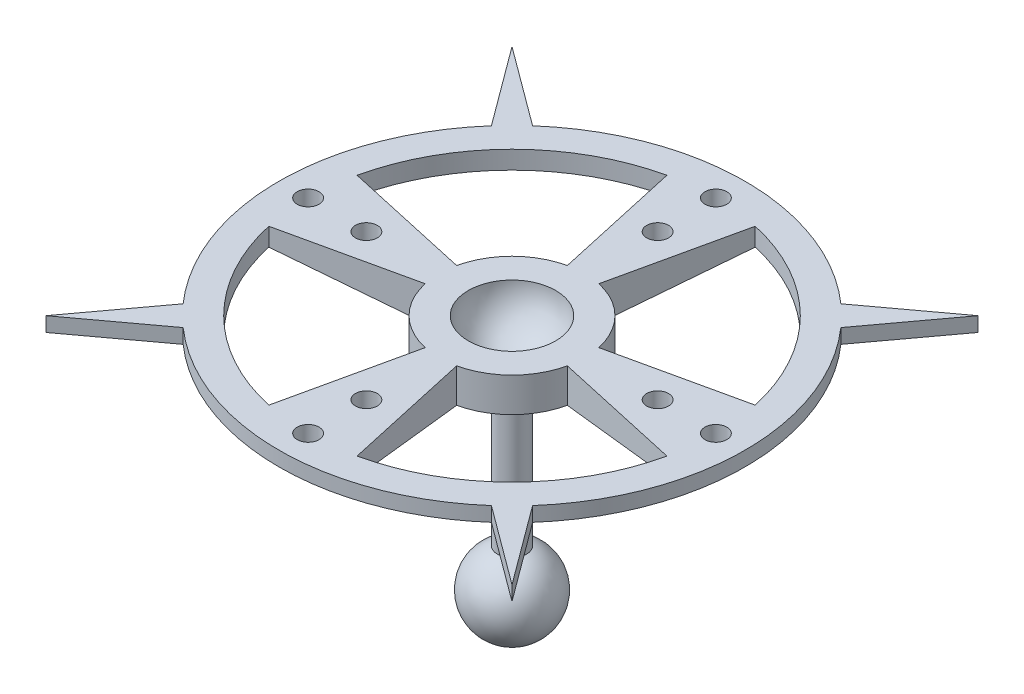
from build123d import *

# Parameters (mm, degrees)
SKETCH4_R           = 0.75
CUT_EXTRUDE2_DEPTH  = 4
BOSS_EXTRUDE2_START = -1
BOSS_EXTRUDE2_DEPTH = 1


with BuildPart() as part:
    # Sketch1 → Revolve1 (revolve)
    with BuildSketch(Plane(origin=(0, 0, 0), x_dir=(0, 0, -1), z_dir=(1, 0, 0))):
        with BuildLine():
            Line((0, -9.5), (0, 0))
            Line((0, 0), (0, 1))
            ThreePointArc((0, 1), (-2.121320344, 1.878679656), (-3, 4))
            Line((-3, 4), (-4, 4))
            Line((-4, 4), (-16, 4))
            Line((-16, 4), (-16, 3))
            Line((-16, 3), (-3.048002331, 1.409694653))
            ThreePointArc((-3.048002331, 1.409694653), (-2.123180734, 0.609999474), (-1, 0.127016654))
            Line((-1, 0.127016654), (-1, -9.684660634))
            ThreePointArc((-1, -9.684660634), (-2.753447859, -12.808453427), (0, -15.1))
            Line((0, -15.1), (0, -9.5))
        make_face()
    revolve(axis=Axis((0, 10.634252877, 0), (0, 1, 0)))

    # Sketch4 → Cut-Extrude2 (cut)
    with BuildSketch(Plane(origin=(0, 4, 0), x_dir=(1, 0, 0), z_dir=(0, 1, 0))):
        with BuildLine():
            Line((-1.08219807, 4.881480036), (-3.030154595, 13.6681441))
            ThreePointArc((-3.030154595, 13.6681441), (-9.899494937, 9.899494937), (-13.6681441, 3.030154595))
            Line((-13.6681441, 3.030154595), (-4.881480036, 1.08219807))
            ThreePointArc((-4.881480036, 1.08219807), (-3.535533906, 3.535533906), (-1.08219807, 4.881480036))
        make_face()
        with Locations((0, 14)):
            Circle(SKETCH4_R)
        with BuildLine():
            ThreePointArc((13.6681441, 3.030154595), (9.899494937, 9.899494937), (3.030154595, 13.6681441))
            Line((3.030154595, 13.6681441), (1.08219807, 4.881480036))
            ThreePointArc((1.08219807, 4.881480036), (3.535533906, 3.535533906), (4.881480036, 1.08219807))
            Line((4.881480036, 1.08219807), (13.6681441, 3.030154595))
        make_face()
        with Locations((-14, 0)):
            Circle(SKETCH4_R)
        with BuildLine():
            Line((-4.881480036, -1.08219807), (-13.6681441, -3.030154595))
            ThreePointArc((-13.6681441, -3.030154595), (-9.899494937, -9.899494937), (-3.030154595, -13.6681441))
            Line((-3.030154595, -13.6681441), (-1.08219807, -4.881480036))
            ThreePointArc((-1.08219807, -4.881480036), (-3.535533906, -3.535533906), (-4.881480036, -1.08219807))
        make_face()
        with Locations((14, 0)):
            Circle(SKETCH4_R)
        with BuildLine():
            ThreePointArc((3.030154595, -13.6681441), (9.899494937, -9.899494937), (13.6681441, -3.030154595))
            Line((13.6681441, -3.030154595), (4.881480036, -1.08219807))
            ThreePointArc((4.881480036, -1.08219807), (3.535533906, -3.535533906), (1.08219807, -4.881480036))
            Line((1.08219807, -4.881480036), (3.030154595, -13.6681441))
        make_face()
        with Locations((0, -14)):
            Circle(SKETCH4_R)
        with Locations((10, 0)):
            Circle(SKETCH4_R)
        with Locations((0, 10)):
            Circle(SKETCH4_R)
        with Locations((0, -10)):
            Circle(SKETCH4_R)
        with Locations((-10, 0)):
            Circle(SKETCH4_R)
    extrude(amount=-CUT_EXTRUDE2_DEPTH, mode=Mode.SUBTRACT)

    # Sketch5 → Boss-Extrude2 (add)
    with BuildSketch(Plane(origin=(0, 4, 0), x_dir=(1, 0, 0), z_dir=(0, 1, 0)).offset(BOSS_EXTRUDE2_START)):
        with BuildLine():
            ThreePointArc((-11.998696572, 10.584483009), (-11.313708499, 11.313708499), (-10.584483009, 11.998696572))
            Line((-10.584483009, 11.998696572), (-16, 16))
            Line((-16, 16), (-11.998696572, 10.584483009))
        make_face()
        with BuildLine():
            Line((16, 16), (10.584483009, 11.998696572))
            ThreePointArc((10.584483009, 11.998696572), (11.313708499, 11.313708499), (11.998696572, 10.584483009))
            Line((11.998696572, 10.584483009), (16, 16))
        make_face()
        with BuildLine():
            ThreePointArc((-10.584483009, -11.998696572), (-11.313708499, -11.313708499), (-11.998696572, -10.584483009))
            Line((-11.998696572, -10.584483009), (-16, -16))
            Line((-16, -16), (-10.584483009, -11.998696572))
        make_face()
        with BuildLine():
            ThreePointArc((11.998696572, -10.584483009), (11.313708499, -11.313708499), (10.584483009, -11.998696572))
            Line((10.584483009, -11.998696572), (16, -16))
            Line((16, -16), (11.998696572, -10.584483009))
        make_face()
    extrude(amount=BOSS_EXTRUDE2_DEPTH)


solid = part.part
